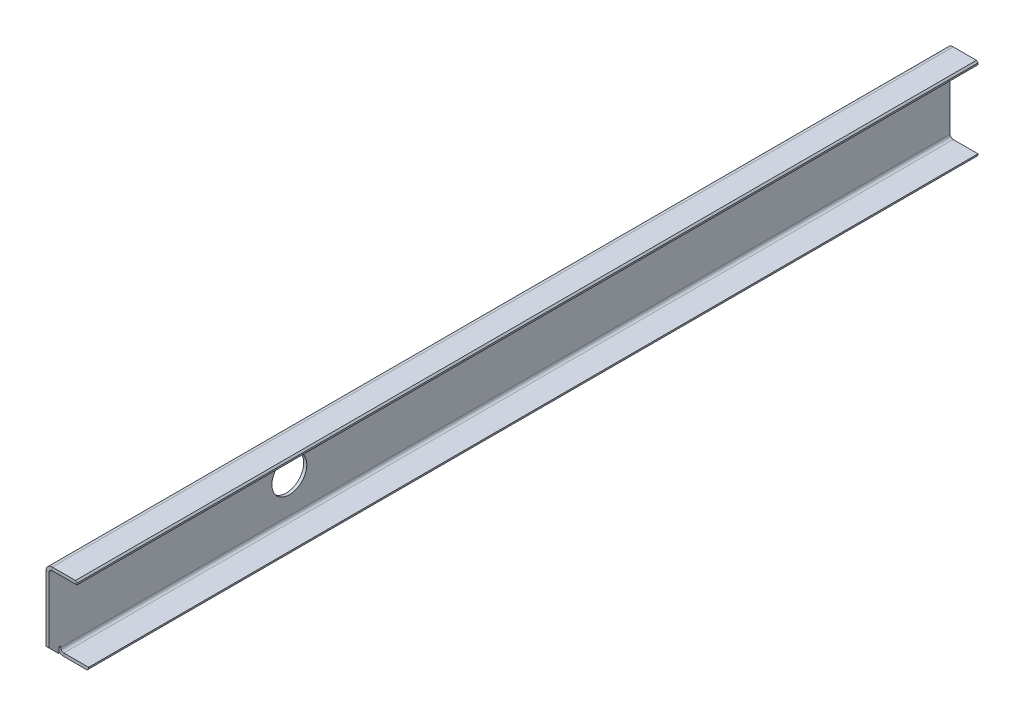
from build123d import *

# Parameters (mm, degrees)
SM_BASE_FLANGE_1_DEPTH             = 8
SM_EDGE_FLANGE_1_STRIP_W           = 48
SM_EDGE_FLANGE_1_STRIP_H           = 8
SM_EDGE_FLANGE_1_STRIP_CUT_DEPTH   = 2325
SM_EDGE_FLANGE_1_STRIP_2_W         = 48
SM_EDGE_FLANGE_1_STRIP_2_H         = 8
SM_EDGE_FLANGE_1_STRIP_CUT_2_DEPTH = 2295
SM_EDGE_FLANGE_1_RELIEF_W          = 52
SM_EDGE_FLANGE_1_RELIEF_H          = 4
SM_EDGE_FLANGE_1_RELIEF_CUT_DEPTH  = 8
SM_EDGE_FLANGE_1_DEPTH             = 2325
SM_EDGE_FLANGE_1_BEND_DEPTH        = 2295
CHAMFER_1_SIZE                     = 4
SKETCH_12_R                        = 45
CUT_EXTRUDE_1_DEPTH                = 2337.029537484


# Sheet-metal steps are written as plain solids
with BuildPart() as part:
    # Sketch 1 → 基体-法兰1 (new body)
    with BuildSketch(Plane(origin=(0, 0, 0), x_dir=(0, 0, -1), z_dir=(1, 0, 0))):
        Polygon((0, 0), (2325, 0), (2325, -215), (30, -215), (0, -185), align=None)
    extrude(amount=-SM_BASE_FLANGE_1_DEPTH)

    # 边线-法兰1 strip (across the edge) → 边线-法兰1 strip cut (cut)
    with BuildSketch(Plane(origin=(0, 0, -2325), x_dir=(0, -1, 0), z_dir=(0, 0, 1))):
        with Locations((-8, -4)):
            Rectangle(SM_EDGE_FLANGE_1_STRIP_W, SM_EDGE_FLANGE_1_STRIP_H)
    extrude(amount=SM_EDGE_FLANGE_1_STRIP_CUT_DEPTH, mode=Mode.SUBTRACT)

    # 边线-法兰1 strip 2 (across the edge) → 边线-法兰1 strip cut 2 (cut)
    with BuildSketch(Plane(origin=(0, -215, -30), x_dir=(0, 1, 0), z_dir=(0, 0, -1))):
        with Locations((-8, -4)):
            Rectangle(SM_EDGE_FLANGE_1_STRIP_2_W, SM_EDGE_FLANGE_1_STRIP_2_H)
    extrude(amount=SM_EDGE_FLANGE_1_STRIP_CUT_2_DEPTH, mode=Mode.SUBTRACT)

    # 边线-法兰1 relief (on the sheet) → 边线-法兰1 relief cut (cut)
    with BuildSketch(Plane(origin=(0, -199, -30), x_dir=(0, 1, 0), z_dir=(1, 0, 0))):
        with Locations((-22, 2)):
            Rectangle(SM_EDGE_FLANGE_1_RELIEF_W, SM_EDGE_FLANGE_1_RELIEF_H)
    extrude(amount=-SM_EDGE_FLANGE_1_RELIEF_CUT_DEPTH, mode=Mode.SUBTRACT)

    # 边线-法兰1 section (across the edge) → 边线-法兰1 (add)
    with BuildSketch(Plane(origin=(0, 0, -2325), x_dir=(0, -1, 0), z_dir=(0, 0, 1))):
        with BuildLine():
            Line((0, 8), (0, 72))
            Line((0, 72), (8, 72))
            Line((8, 72), (8, 8))
            ThreePointArc((8, 8), (10.343145751, 2.343145751), (16, 0))
            Line((16, 0), (16, -8))
            ThreePointArc((16, -8), (4.686291501, -3.313708499), (0, 8))
        make_face()
    extrude(amount=SM_EDGE_FLANGE_1_DEPTH)

    # 边线-法兰1 section 2 (across the edge) → 边线-法兰1 bend (add)
    with BuildSketch(Plane(origin=(0, -215, -30), x_dir=(0, 1, 0), z_dir=(0, 0, -1))):
        with BuildLine():
            Line((0, 8), (0, 72))
            Line((0, 72), (8, 72))
            Line((8, 72), (8, 8))
            ThreePointArc((8, 8), (10.343145751, 2.343145751), (16, 0))
            Line((16, 0), (16, -8))
            ThreePointArc((16, -8), (4.686291501, -3.313708499), (0, 8))
        make_face()
    extrude(amount=SM_EDGE_FLANGE_1_BEND_DEPTH)

    # 倒角1
    chamfer_1_edges = [part.edges().sort_by_distance(p)[0] for p in [
        (72, 0, -1162.5),
        (72, -215, -1177.5),
    ]]
    chamfer(chamfer_1_edges, length=CHAMFER_1_SIZE)

    # 草图12 → 切除-拉伸1 (cut, through all)
    with BuildSketch(Plane(origin=(0, 0, 0), x_dir=(0, 0, -1), z_dir=(1, 0, 0))):
        with Locations((620, -107.5)):
            Circle(SKETCH_12_R)
    extrude(amount=-CUT_EXTRUDE_1_DEPTH, mode=Mode.SUBTRACT)


solid = part.part
